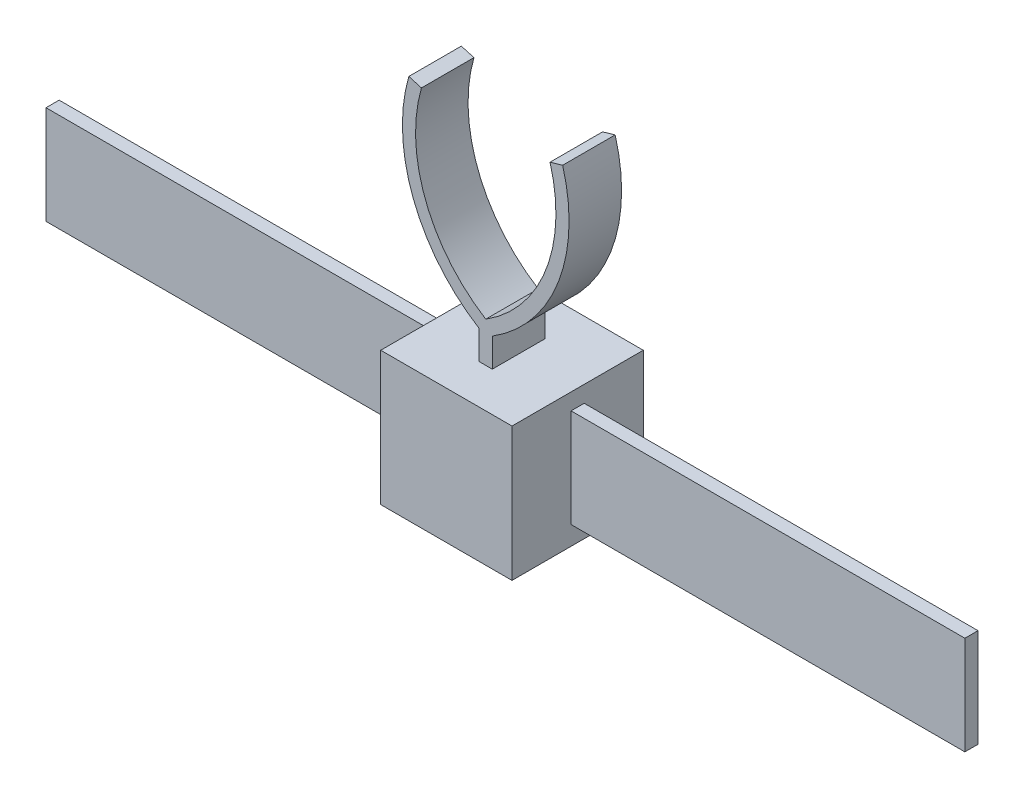
from build123d import *

# Parameters (mm, degrees)
SKETCH1_W                = 100
SKETCH1_H                = 101.866666666
BOSS_EXTRUDE1_DEPTH      = 100
BOSS_EXTRUDE2_DEPTH      = 300
BOSS_EXTRUDE2_DEPTH_BACK = 400
SKETCH2_W                = 10
SKETCH2_H                = 75
EXTRUDE_THIN1_START      = -20
EXTRUDE_THIN1_DEPTH      = 40


# Read off the part's stored shape, not the designer's step: Extrude-Thin1
with BuildPart() as part:
    # Sketch1 → Boss-Extrude1 (new body)
    with BuildSketch(Plane.XY):
        Rectangle(SKETCH1_W, SKETCH1_H)
    extrude(amount=BOSS_EXTRUDE1_DEPTH)

    # Sketch2 → Boss-Extrude2 (add, two sides: drawn at the far end of the back side and taken through both)
    with BuildSketch(Plane(origin=(50, 0, 0), x_dir=(0, 0, -1), z_dir=(1, 0, 0)).offset(-BOSS_EXTRUDE2_DEPTH_BACK)):
        with Locations((-50, 0.933333333)):
            Rectangle(SKETCH2_W, SKETCH2_H)
    extrude(amount=BOSS_EXTRUDE2_DEPTH + BOSS_EXTRUDE2_DEPTH_BACK)

    # Extrude-Thin1 outline → Extrude-Thin1 (add)
    with BuildSketch(Plane.XY.offset(50).offset(EXTRUDE_THIN1_START)):
        with BuildLine():
            Line((5, 50.933333333), (5, 72.767361549))
            ThreePointArc((5, 72.767361549), (55.2653102, 133.511715936), (58.591267344, 212.286178857))
            Line((58.591267344, 212.286178857), (48.987221146, 209.500089011))
            ThreePointArc((48.987221146, 209.500089011), (45.987027323, 137.245454908), (0, 81.433927153))
            ThreePointArc((0, 81.433927153), (-45.987027323, 137.245454908), (-48.987221146, 209.500089011))
            Line((-48.987221146, 209.500089011), (-58.591267344, 212.286178857))
            ThreePointArc((-58.591267344, 212.286178857), (-55.2653102, 133.511715936), (-5, 72.767361549))
            Line((-5, 72.767361549), (-5, 50.933333333))
            Line((-5, 50.933333333), (5, 50.933333333))
        make_face()
    extrude(amount=EXTRUDE_THIN1_DEPTH)


solid = part.part
